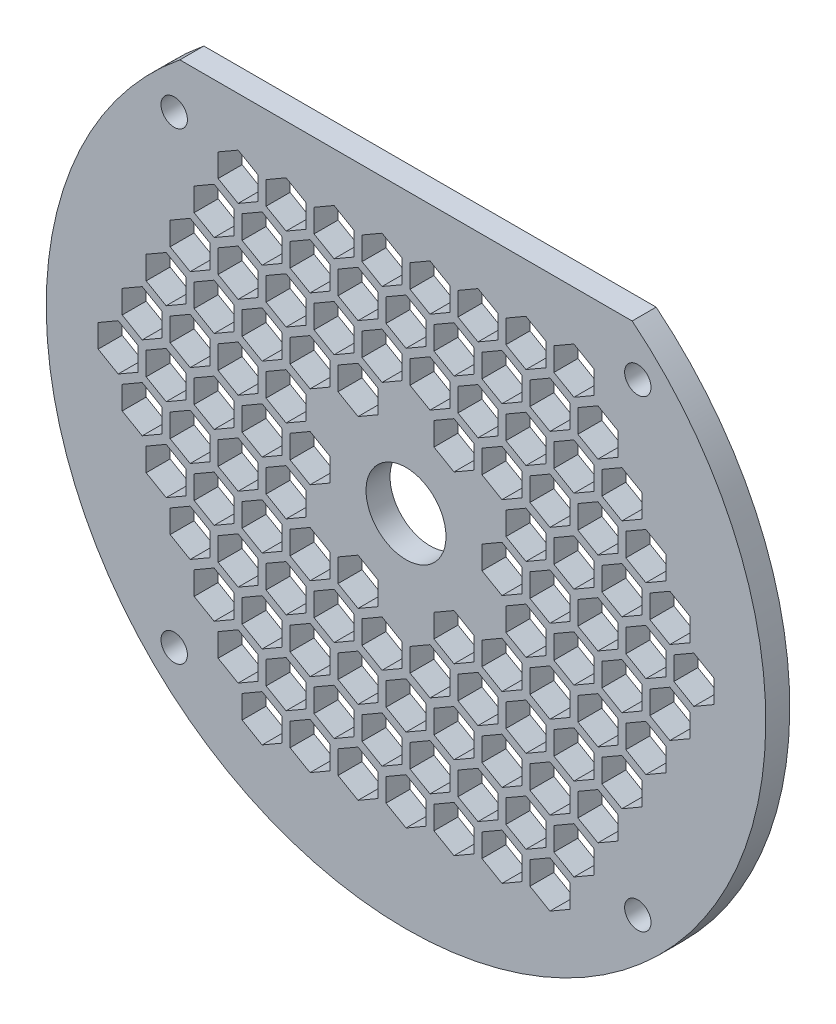
from build123d import *

# Parameters (mm, degrees)
SKETCH_1_R           = 90
EXTRUDE_1_DEPTH      = 6
SKETCH_2_W           = 400
SKETCH_2_H           = 140
CUT_EXTRUDE_1_DEPTH  = 128.42056349
CUT_EXTRUDE_4_DEPTH  = 128.42056349
CUT_EXTRUDE_6_DEPTH  = 128.42056349
CUT_EXTRUDE_8_DEPTH  = 128.42056349
SKETCH_10_R          = 10
CUT_EXTRUDE_9_DEPTH  = 128.42056349
SKETCH_11_R          = 3.3
CUT_EXTRUDE_10_DEPTH = 128.42056349


with BuildPart() as part:
    # 草图1 → 凸台-拉伸1 (new body)
    with BuildSketch(Plane.XY):
        Circle(SKETCH_1_R)
    extrude(amount=EXTRUDE_1_DEPTH)

    # 草图2 → 切除-拉伸1 (cut, through all)
    with BuildSketch(Plane.XY):
        with Locations((0, 140)):
            Rectangle(SKETCH_2_W, SKETCH_2_H)
    extrude(amount=CUT_EXTRUDE_1_DEPTH, mode=Mode.SUBTRACT)

    # 草图5 → 切除-拉伸4 (cut, through all)
    with BuildSketch(Plane.XY):
        Polygon((24, 5.773502692), (19, 2.886751346), (19, -2.886751346), (24, -5.773502692), (29, -2.886751346), (29, 2.886751346), align=None)
        Polygon((-24, 5.773502692), (-29, 2.886751346), (-29, -2.886751346), (-24, -5.773502692), (-19, -2.886751346), (-19, 2.886751346), align=None)
        Polygon((36, 5.773502692), (31, 2.886751346), (31, -2.886751346), (36, -5.773502692), (41, -2.886751346), (41, 2.886751346), align=None)
        Polygon((-36, 5.773502692), (-41, 2.886751346), (-41, -2.886751346), (-36, -5.773502692), (-31, -2.886751346), (-31, 2.886751346), align=None)
        Polygon((48, 5.773502692), (43, 2.886751346), (43, -2.886751346), (48, -5.773502692), (53, -2.886751346), (53, 2.886751346), align=None)
        Polygon((-48, 5.773502692), (-53, 2.886751346), (-53, -2.886751346), (-48, -5.773502692), (-43, -2.886751346), (-43, 2.886751346), align=None)
        Polygon((60, 5.773502692), (55, 2.886751346), (55, -2.886751346), (60, -5.773502692), (65, -2.886751346), (65, 2.886751346), align=None)
        Polygon((-60, 5.773502692), (-65, 2.886751346), (-65, -2.886751346), (-60, -5.773502692), (-55, -2.886751346), (-55, 2.886751346), align=None)
        Polygon((72, 5.773502692), (67, 2.886751346), (67, -2.886751346), (72, -5.773502692), (77, -2.886751346), (77, 2.886751346), align=None)
        Polygon((-72, 5.773502692), (-77, 2.886751346), (-77, -2.886751346), (-72, -5.773502692), (-67, -2.886751346), (-67, 2.886751346), align=None)
        Polygon((30, 16.165502692), (25, 13.278751346), (25, 7.505248654), (30, 4.618497308), (35, 7.505248654), (35, 13.278751346), align=None)
        Polygon((-30, 16.165502692), (-35, 13.278751346), (-35, 7.505248654), (-30, 4.618497308), (-25, 7.505248654), (-25, 13.278751346), align=None)
        Polygon((42, 16.165502692), (37, 13.278751346), (37, 7.505248654), (42, 4.618497308), (47, 7.505248654), (47, 13.278751346), align=None)
        Polygon((-42, 16.165502692), (-47, 13.278751346), (-47, 7.505248654), (-42, 4.618497308), (-37, 7.505248654), (-37, 13.278751346), align=None)
        Polygon((54, 16.165502692), (49, 13.278751346), (49, 7.505248654), (54, 4.618497308), (59, 7.505248654), (59, 13.278751346), align=None)
        Polygon((-54, 16.165502692), (-59, 13.278751346), (-59, 7.505248654), (-54, 4.618497308), (-49, 7.505248654), (-49, 13.278751346), align=None)
        Polygon((66, 16.165502692), (61, 13.278751346), (61, 7.505248654), (66, 4.618497308), (71, 7.505248654), (71, 13.278751346), align=None)
        Polygon((-66, 16.165502692), (-71, 13.278751346), (-71, 7.505248654), (-66, 4.618497308), (-61, 7.505248654), (-61, 13.278751346), align=None)
        Polygon((30, -4.618497308), (25, -7.505248654), (25, -13.278751346), (30, -16.165502692), (35, -13.278751346), (35, -7.505248654), align=None)
        Polygon((-30, -4.618497308), (-35, -7.505248654), (-35, -13.278751346), (-30, -16.165502692), (-25, -13.278751346), (-25, -7.505248654), align=None)
        Polygon((42, -4.618497308), (37, -7.505248654), (37, -13.278751346), (42, -16.165502692), (47, -13.278751346), (47, -7.505248654), align=None)
        Polygon((-42, -4.618497308), (-47, -7.505248654), (-47, -13.278751346), (-42, -16.165502692), (-37, -13.278751346), (-37, -7.505248654), align=None)
        Polygon((54, -4.618497308), (49, -7.505248654), (49, -13.278751346), (54, -16.165502692), (59, -13.278751346), (59, -7.505248654), align=None)
        Polygon((-54, -4.618497308), (-59, -7.505248654), (-59, -13.278751346), (-54, -16.165502692), (-49, -13.278751346), (-49, -7.505248654), align=None)
        Polygon((66, -4.618497308), (61, -7.505248654), (61, -13.278751346), (66, -16.165502692), (71, -13.278751346), (71, -7.505248654), align=None)
        Polygon((-66, -4.618497308), (-71, -7.505248654), (-71, -13.278751346), (-66, -16.165502692), (-61, -13.278751346), (-61, -7.505248654), align=None)
    extrude(amount=CUT_EXTRUDE_4_DEPTH, mode=Mode.SUBTRACT)

    # 草图7 → 切除-拉伸6 (cut, through all)
    with BuildSketch(Plane.XY):
        Polygon((12, 26.557502692), (7, 23.670751346), (7, 17.897248654), (12, 15.010497308), (17, 17.897248654), (17, 23.670751346), align=None)
        Polygon((-12, 26.557502692), (-17, 23.670751346), (-17, 17.897248654), (-12, 15.010497308), (-7, 17.897248654), (-7, 23.670751346), align=None)
        Polygon((24, 26.557502692), (19, 23.670751346), (19, 17.897248654), (24, 15.010497308), (29, 17.897248654), (29, 23.670751346), align=None)
        Polygon((-24, 26.557502692), (-29, 23.670751346), (-29, 17.897248654), (-24, 15.010497308), (-19, 17.897248654), (-19, 23.670751346), align=None)
        Polygon((36, 26.557502692), (31, 23.670751346), (31, 17.897248654), (36, 15.010497308), (41, 17.897248654), (41, 23.670751346), align=None)
        Polygon((-36, 26.557502692), (-41, 23.670751346), (-41, 17.897248654), (-36, 15.010497308), (-31, 17.897248654), (-31, 23.670751346), align=None)
        Polygon((48, 26.557502692), (43, 23.670751346), (43, 17.897248654), (48, 15.010497308), (53, 17.897248654), (53, 23.670751346), align=None)
        Polygon((-48, 26.557502692), (-53, 23.670751346), (-53, 17.897248654), (-48, 15.010497308), (-43, 17.897248654), (-43, 23.670751346), align=None)
        Polygon((60, 26.557502692), (55, 23.670751346), (55, 17.897248654), (60, 15.010497308), (65, 17.897248654), (65, 23.670751346), align=None)
        Polygon((-60, 26.557502692), (-65, 23.670751346), (-65, 17.897248654), (-60, 15.010497308), (-55, 17.897248654), (-55, 23.670751346), align=None)
        Polygon((12, -15.010497308), (7, -17.897248654), (7, -23.670751346), (12, -26.557502692), (17, -23.670751346), (17, -17.897248654), align=None)
        Polygon((-12, -15.010497308), (-17, -17.897248654), (-17, -23.670751346), (-12, -26.557502692), (-7, -23.670751346), (-7, -17.897248654), align=None)
        Polygon((24, -15.010497308), (19, -17.897248654), (19, -23.670751346), (24, -26.557502692), (29, -23.670751346), (29, -17.897248654), align=None)
        Polygon((-24, -15.010497308), (-29, -17.897248654), (-29, -23.670751346), (-24, -26.557502692), (-19, -23.670751346), (-19, -17.897248654), align=None)
        Polygon((36, -15.010497308), (31, -17.897248654), (31, -23.670751346), (36, -26.557502692), (41, -23.670751346), (41, -17.897248654), align=None)
        Polygon((-36, -15.010497308), (-41, -17.897248654), (-41, -23.670751346), (-36, -26.557502692), (-31, -23.670751346), (-31, -17.897248654), align=None)
        Polygon((48, -15.010497308), (43, -17.897248654), (43, -23.670751346), (48, -26.557502692), (53, -23.670751346), (53, -17.897248654), align=None)
        Polygon((-48, -15.010497308), (-53, -17.897248654), (-53, -23.670751346), (-48, -26.557502692), (-43, -23.670751346), (-43, -17.897248654), align=None)
        Polygon((60, -15.010497308), (55, -17.897248654), (55, -23.670751346), (60, -26.557502692), (65, -23.670751346), (65, -17.897248654), align=None)
        Polygon((-60, -15.010497308), (-65, -17.897248654), (-65, -23.670751346), (-60, -26.557502692), (-55, -23.670751346), (-55, -17.897248654), align=None)
        Polygon((6, 36.949502692), (1, 34.062751346), (1, 28.289248654), (6, 25.402497308), (11, 28.289248654), (11, 34.062751346), align=None)
        Polygon((-6, 36.949502692), (-11, 34.062751346), (-11, 28.289248654), (-6, 25.402497308), (-1, 28.289248654), (-1, 34.062751346), align=None)
        Polygon((18, 36.949502692), (13, 34.062751346), (13, 28.289248654), (18, 25.402497308), (23, 28.289248654), (23, 34.062751346), align=None)
        Polygon((-18, 36.949502692), (-23, 34.062751346), (-23, 28.289248654), (-18, 25.402497308), (-13, 28.289248654), (-13, 34.062751346), align=None)
        Polygon((30, 36.949502692), (25, 34.062751346), (25, 28.289248654), (30, 25.402497308), (35, 28.289248654), (35, 34.062751346), align=None)
        Polygon((-30, 36.949502692), (-35, 34.062751346), (-35, 28.289248654), (-30, 25.402497308), (-25, 28.289248654), (-25, 34.062751346), align=None)
        Polygon((42, 36.949502692), (37, 34.062751346), (37, 28.289248654), (42, 25.402497308), (47, 28.289248654), (47, 34.062751346), align=None)
        Polygon((-42, 36.949502692), (-47, 34.062751346), (-47, 28.289248654), (-42, 25.402497308), (-37, 28.289248654), (-37, 34.062751346), align=None)
        Polygon((54, 36.949502692), (49, 34.062751346), (49, 28.289248654), (54, 25.402497308), (59, 28.289248654), (59, 34.062751346), align=None)
        Polygon((-54, 36.949502692), (-59, 34.062751346), (-59, 28.289248654), (-54, 25.402497308), (-49, 28.289248654), (-49, 34.062751346), align=None)
        Polygon((6, -25.402497308), (1, -28.289248654), (1, -34.062751346), (6, -36.949502692), (11, -34.062751346), (11, -28.289248654), align=None)
        Polygon((-6, -25.402497308), (-11, -28.289248654), (-11, -34.062751346), (-6, -36.949502692), (-1, -34.062751346), (-1, -28.289248654), align=None)
        Polygon((18, -25.402497308), (13, -28.289248654), (13, -34.062751346), (18, -36.949502692), (23, -34.062751346), (23, -28.289248654), align=None)
        Polygon((-18, -25.402497308), (-23, -28.289248654), (-23, -34.062751346), (-18, -36.949502692), (-13, -34.062751346), (-13, -28.289248654), align=None)
        Polygon((30, -25.402497308), (25, -28.289248654), (25, -34.062751346), (30, -36.949502692), (35, -34.062751346), (35, -28.289248654), align=None)
        Polygon((-30, -25.402497308), (-35, -28.289248654), (-35, -34.062751346), (-30, -36.949502692), (-25, -34.062751346), (-25, -28.289248654), align=None)
        Polygon((42, -25.402497308), (37, -28.289248654), (37, -34.062751346), (42, -36.949502692), (47, -34.062751346), (47, -28.289248654), align=None)
        Polygon((-42, -25.402497308), (-47, -28.289248654), (-47, -34.062751346), (-42, -36.949502692), (-37, -34.062751346), (-37, -28.289248654), align=None)
        Polygon((54, -25.402497308), (49, -28.289248654), (49, -34.062751346), (54, -36.949502692), (59, -34.062751346), (59, -28.289248654), align=None)
        Polygon((-54, -25.402497308), (-59, -28.289248654), (-59, -34.062751346), (-54, -36.949502692), (-49, -34.062751346), (-49, -28.289248654), align=None)
        Polygon((0, 47.341502692), (-5, 44.454751346), (-5, 38.681248654), (0, 35.794497308), (5, 38.681248654), (5, 44.454751346), align=None)
        Polygon((12, 47.341502692), (7, 44.454751346), (7, 38.681248654), (12, 35.794497308), (17, 38.681248654), (17, 44.454751346), align=None)
        Polygon((-12, 47.341502692), (-17, 44.454751346), (-17, 38.681248654), (-12, 35.794497308), (-7, 38.681248654), (-7, 44.454751346), align=None)
        Polygon((24, 47.341502692), (19, 44.454751346), (19, 38.681248654), (24, 35.794497308), (29, 38.681248654), (29, 44.454751346), align=None)
        Polygon((-24, 47.341502692), (-29, 44.454751346), (-29, 38.681248654), (-24, 35.794497308), (-19, 38.681248654), (-19, 44.454751346), align=None)
        Polygon((36, 47.341502692), (31, 44.454751346), (31, 38.681248654), (36, 35.794497308), (41, 38.681248654), (41, 44.454751346), align=None)
        Polygon((-36, 47.341502692), (-41, 44.454751346), (-41, 38.681248654), (-36, 35.794497308), (-31, 38.681248654), (-31, 44.454751346), align=None)
        Polygon((48, 47.341502692), (43, 44.454751346), (43, 38.681248654), (48, 35.794497308), (53, 38.681248654), (53, 44.454751346), align=None)
        Polygon((-48, 47.341502692), (-53, 44.454751346), (-53, 38.681248654), (-48, 35.794497308), (-43, 38.681248654), (-43, 44.454751346), align=None)
        Polygon((0, -35.794497308), (-5, -38.681248654), (-5, -44.454751346), (0, -47.341502692), (5, -44.454751346), (5, -38.681248654), align=None)
        Polygon((12, -35.794497308), (7, -38.681248654), (7, -44.454751346), (12, -47.341502692), (17, -44.454751346), (17, -38.681248654), align=None)
        Polygon((-12, -35.794497308), (-17, -38.681248654), (-17, -44.454751346), (-12, -47.341502692), (-7, -44.454751346), (-7, -38.681248654), align=None)
        Polygon((24, -35.794497308), (19, -38.681248654), (19, -44.454751346), (24, -47.341502692), (29, -44.454751346), (29, -38.681248654), align=None)
        Polygon((-24, -35.794497308), (-29, -38.681248654), (-29, -44.454751346), (-24, -47.341502692), (-19, -44.454751346), (-19, -38.681248654), align=None)
        Polygon((36, -35.794497308), (31, -38.681248654), (31, -44.454751346), (36, -47.341502692), (41, -44.454751346), (41, -38.681248654), align=None)
        Polygon((-36, -35.794497308), (-41, -38.681248654), (-41, -44.454751346), (-36, -47.341502692), (-31, -44.454751346), (-31, -38.681248654), align=None)
        Polygon((48, -35.794497308), (43, -38.681248654), (43, -44.454751346), (48, -47.341502692), (53, -44.454751346), (53, -38.681248654), align=None)
        Polygon((-48, -35.794497308), (-53, -38.681248654), (-53, -44.454751346), (-48, -47.341502692), (-43, -44.454751346), (-43, -38.681248654), align=None)
    extrude(amount=CUT_EXTRUDE_6_DEPTH, mode=Mode.SUBTRACT)

    # 草图9 → 切除-拉伸8 (cut, through all)
    with BuildSketch(Plane.XY):
        Polygon((6, 57.733502692), (1, 54.846751346), (1, 49.073248654), (6, 46.186497308), (11, 49.073248654), (11, 54.846751346), align=None)
        Polygon((-6, 57.733502692), (-11, 54.846751346), (-11, 49.073248654), (-6, 46.186497308), (-1, 49.073248654), (-1, 54.846751346), align=None)
        Polygon((18, 57.733502692), (13, 54.846751346), (13, 49.073248654), (18, 46.186497308), (23, 49.073248654), (23, 54.846751346), align=None)
        Polygon((-18, 57.733502692), (-23, 54.846751346), (-23, 49.073248654), (-18, 46.186497308), (-13, 49.073248654), (-13, 54.846751346), align=None)
        Polygon((30, 57.733502692), (25, 54.846751346), (25, 49.073248654), (30, 46.186497308), (35, 49.073248654), (35, 54.846751346), align=None)
        Polygon((-30, 57.733502692), (-35, 54.846751346), (-35, 49.073248654), (-30, 46.186497308), (-25, 49.073248654), (-25, 54.846751346), align=None)
        Polygon((42, 57.733502692), (37, 54.846751346), (37, 49.073248654), (42, 46.186497308), (47, 49.073248654), (47, 54.846751346), align=None)
        Polygon((-42, 57.733502692), (-47, 54.846751346), (-47, 49.073248654), (-42, 46.186497308), (-37, 49.073248654), (-37, 54.846751346), align=None)
        Polygon((6, -46.186497308), (1, -49.073248654), (1, -54.846751346), (6, -57.733502692), (11, -54.846751346), (11, -49.073248654), align=None)
        Polygon((-6, -46.186497308), (-11, -49.073248654), (-11, -54.846751346), (-6, -57.733502692), (-1, -54.846751346), (-1, -49.073248654), align=None)
        Polygon((18, -46.186497308), (13, -49.073248654), (13, -54.846751346), (18, -57.733502692), (23, -54.846751346), (23, -49.073248654), align=None)
        Polygon((-18, -46.186497308), (-23, -49.073248654), (-23, -54.846751346), (-18, -57.733502692), (-13, -54.846751346), (-13, -49.073248654), align=None)
        Polygon((30, -46.186497308), (25, -49.073248654), (25, -54.846751346), (30, -57.733502692), (35, -54.846751346), (35, -49.073248654), align=None)
        Polygon((-30, -46.186497308), (-35, -49.073248654), (-35, -54.846751346), (-30, -57.733502692), (-25, -54.846751346), (-25, -49.073248654), align=None)
        Polygon((42, -46.186497308), (37, -49.073248654), (37, -54.846751346), (42, -57.733502692), (47, -54.846751346), (47, -49.073248654), align=None)
        Polygon((-42, -46.186497308), (-47, -49.073248654), (-47, -54.846751346), (-42, -57.733502692), (-37, -54.846751346), (-37, -49.073248654), align=None)
        Polygon((0, -56.578497308), (-5, -59.465248654), (-5, -65.238751346), (0, -68.125502692), (5, -65.238751346), (5, -59.465248654), align=None)
        Polygon((12, -56.578497308), (7, -59.465248654), (7, -65.238751346), (12, -68.125502692), (17, -65.238751346), (17, -59.465248654), align=None)
        Polygon((-12, -56.578497308), (-17, -59.465248654), (-17, -65.238751346), (-12, -68.125502692), (-7, -65.238751346), (-7, -59.465248654), align=None)
        Polygon((24, -56.578497308), (19, -59.465248654), (19, -65.238751346), (24, -68.125502692), (29, -65.238751346), (29, -59.465248654), align=None)
        Polygon((-24, -56.578497308), (-29, -59.465248654), (-29, -65.238751346), (-24, -68.125502692), (-19, -65.238751346), (-19, -59.465248654), align=None)
        Polygon((36, -56.578497308), (31, -59.465248654), (31, -65.238751346), (36, -68.125502692), (41, -65.238751346), (41, -59.465248654), align=None)
        Polygon((-36, -56.578497308), (-41, -59.465248654), (-41, -65.238751346), (-36, -68.125502692), (-31, -65.238751346), (-31, -59.465248654), align=None)
    extrude(amount=CUT_EXTRUDE_8_DEPTH, mode=Mode.SUBTRACT)

    # 草图10 → 切除-拉伸9 (cut, through all)
    with BuildSketch(Plane.XY):
        Circle(SKETCH_10_R)
    extrude(amount=CUT_EXTRUDE_9_DEPTH, mode=Mode.SUBTRACT)

    # 草图11 → 切除-拉伸10 (cut, through all)
    with BuildSketch(Plane.XY):
        with Locations((57.983, 57.983)):
            Circle(SKETCH_11_R)
        with Locations((-57.983, 57.983)):
            Circle(SKETCH_11_R)
        with Locations((-57.983, -57.983)):
            Circle(SKETCH_11_R)
        with Locations((57.983, -57.983)):
            Circle(SKETCH_11_R)
    extrude(amount=CUT_EXTRUDE_10_DEPTH, mode=Mode.SUBTRACT)


solid = part.part
